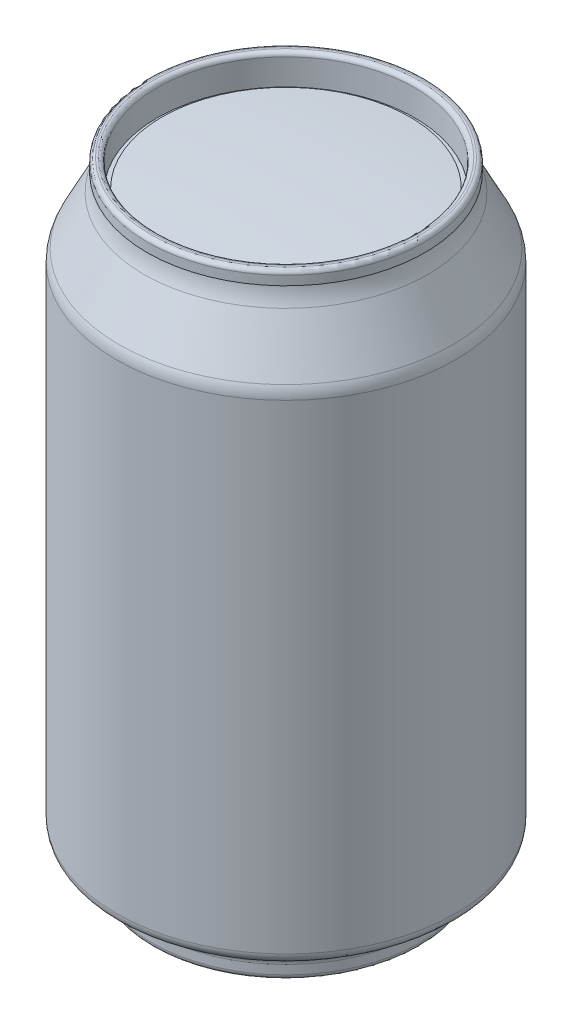
from build123d import *

# Parameters (mm, degrees)
SKETCH2_R      = 33.07
EXTRUDE1_DEPTH = 60.325
FILLET1_R      = 5
FILLET2_R      = 0.813923365
FILLET3_R      = 1


# Read off the part's stored shape, not the designer's step: Shell12
with BuildPart() as part:
    # Sketch2 → Extrude1 (new, symmetric)
    with BuildSketch(Plane(origin=(0, 0, 0), x_dir=(1, 0, 0), z_dir=(0, 1, 0))):
        with Locations(Location((0, 0, 0), (0, 0, 90))):
            Circle(SKETCH2_R)
    extrude(amount=EXTRUDE1_DEPTH, both=True)

    # Sketch3 → Cut-Revolve1 (revolve, cut)
    with BuildSketch(Plane.XY, mode=Mode.PRIVATE) as cut_revolve1_sk:
        with BuildLine():
            Line((33.07, 43.825), (27.701734851, 54.360813578))
            ThreePointArc((27.701734851, 54.360813578), (27.061509387, 55.966678123), (26.725469209, 57.662486656))
            Line((26.725469209, 57.662486656), (27.08, 57.725))
            Line((27.08, 57.725), (27.08, 60.325))
            Line((27.08, 60.325), (33.07, 60.325))
            Line((33.07, 60.325), (33.07, 43.825))
        make_face()
        with BuildLine():
            Line((24.18, 55.00431056), (24.18, 54.425))
            Line((24.18, 54.425), (25.08, 54.425))
            Line((25.08, 54.425), (25.08, 60.325))
            Line((25.08, 60.325), (0, 60.325))
            Line((0, 60.325), (0, 56.015))
            ThreePointArc((0, 56.015), (12.100556735, 55.762217374), (24.18, 55.00431056))
        make_face()
    revolve(cut_revolve1_sk.sketch.rotate(Axis((0, 66.3575, 0), (0, -1, 0)), 90), axis=Axis((0, 66.3575, 0), (0, -1, 0)), mode=Mode.SUBTRACT)

    # Fillet1
    fillet1_edges = [part.edges().sort_by_distance(p)[0] for p in [
        (-33.07, 43.825, 0),
    ]]
    fillet(fillet1_edges, radius=FILLET1_R)

    # Fillet2
    fillet2_edges = [part.edges().sort_by_distance(p)[0] for p in [
        (0, 60.325, -25.08),
        (0, 60.325, -27.08),
    ]]
    fillet(fillet2_edges, radius=FILLET2_R)

    # Sketch4 → Cut-Revolve2 (revolve, cut)
    with BuildSketch(Plane.XY, mode=Mode.PRIVATE) as cut_revolve2_sk:
        with BuildLine():
            Line((0, -49.125), (0, -60.325))
            Line((0, -60.325), (23.545, -60.325))
            Line((23.545, -60.325), (23.545, -57.575))
            ThreePointArc((23.545, -57.575), (12.507692883, -51.301465512), (0, -49.125))
        make_face()
        with BuildLine():
            Line((33.5, -60.325), (33.5, -50.825))
            Line((33.5, -50.825), (33.07, -50.825))
            ThreePointArc((33.07, -50.825), (32.774535338, -51.966631989), (31.951815594, -52.811472321))
            Line((31.951815594, -52.811472321), (27.160198994, -55.678643368))
            ThreePointArc((27.160198994, -55.678643368), (26.372501012, -56.485020487), (26.085, -57.575))
            Line((26.085, -57.575), (26.085, -60.325))
            Line((26.085, -60.325), (33.5, -60.325))
        make_face()
    revolve(cut_revolve2_sk.sketch.rotate(Axis((0, 66.3575, 0), (0, -1, 0)), 90), axis=Axis((0, 66.3575, 0), (0, -1, 0)), mode=Mode.SUBTRACT)

    # Fillet3
    fillet3_edges = [part.edges().sort_by_distance(p)[0] for p in [
        (0, -60.325, -23.545),
        (0, -60.325, -26.085),
    ]]
    fillet(fillet3_edges, radius=FILLET3_R)

    # Shell12 outline → Shell12 (revolve, cut)
    with BuildSketch(Plane.XY):
        with BuildLine():
            ThreePointArc((32.84, 42.624606205), (32.70820452, 43.73814059), (32.32010112, 44.790140888))
            Line((32.32010112, 44.790140888), (27.49680335, 54.256395763))
            ThreePointArc((27.49680335, 54.256395763), (26.81111619, 56.004455596), (26.476866639, 57.852199436))
            Line((26.476866639, 57.852199436), (26.85, 57.917992915))
            Line((26.85, 57.917992915), (26.85, 59.511076635))
            ThreePointArc((26.85, 59.511076635), (26.678972806, 59.923972806), (26.266076635, 60.095))
            Line((26.266076635, 60.095), (25.893923365, 60.095))
            ThreePointArc((25.893923365, 60.095), (25.481027194, 59.923972806), (25.31, 59.511076635))
            Line((25.31, 59.511076635), (25.31, 54.195))
            Line((25.31, 54.195), (23.95, 54.195))
            Line((23.95, 54.195), (23.950000096, 54.792688913))
            ThreePointArc((23.950000096, 54.792688913), (11.985274151, 55.536815853), (0, 55.785))
            Line((0, 55.785), (0, -48.895))
            ThreePointArc((0, -48.895), (12.636500179, -51.103371375), (23.775000029, -57.466692993))
            Line((23.775000029, -57.466692993), (23.775, -59.325))
            ThreePointArc((23.775, -59.325), (24.000527778, -59.869472222), (24.545, -60.095))
            Line((24.545, -60.095), (25.085, -60.095))
            ThreePointArc((25.085, -60.095), (25.629472222, -59.869472222), (25.855, -59.325))
            Line((25.855, -59.325), (25.855, -57.575))
            ThreePointArc((25.855, -57.575), (26.172422927, -56.371579929), (27.042101257, -55.481278415))
            Line((27.042101257, -55.481278415), (31.833717857, -52.614107368))
            ThreePointArc((31.833717857, -52.614107368), (32.56762201, -51.865246929), (32.84, -50.852716685))
            Line((32.84, -50.852716685), (32.84, 42.624606205))
        make_face()
    revolve(axis=Axis((0, 0, 0), (0, 1, 0)), mode=Mode.SUBTRACT)


solid = part.part
